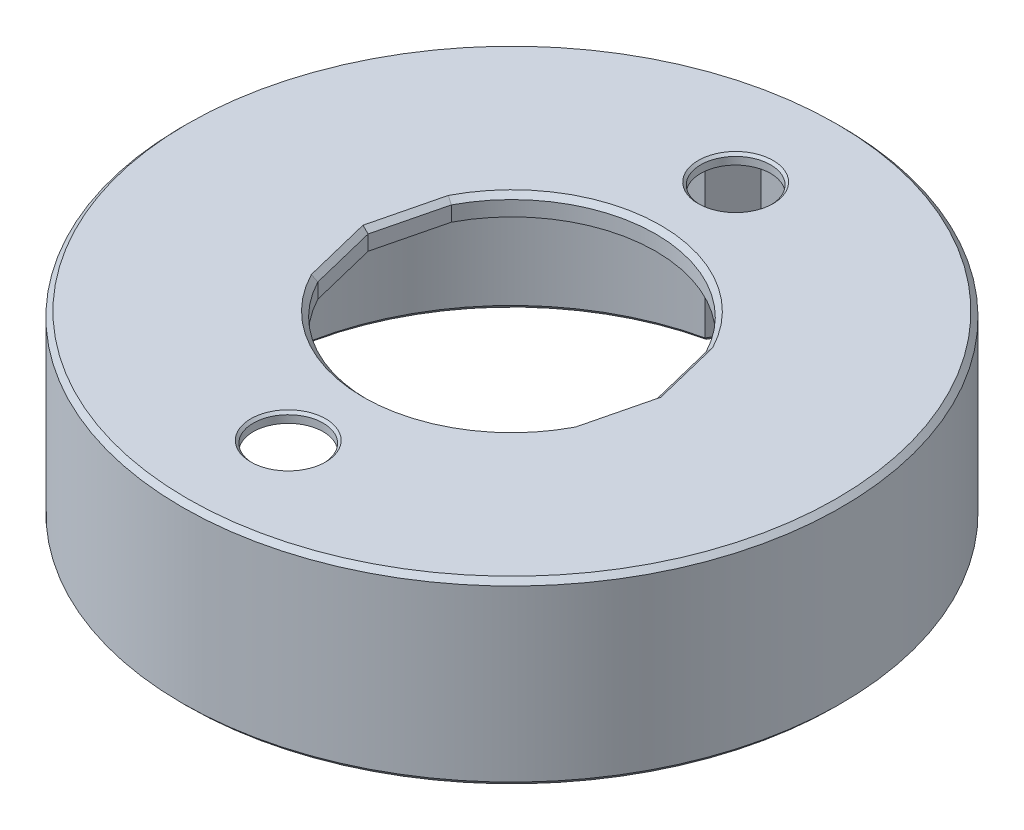
from build123d import *

# Parameters (mm, degrees)
SKETCH1_R           = 16.5
SKETCH1_R_2         = 12.73
BOSS_EXTRUDE1_DEPTH = 8
SKETCH2_R           = 16.5
BOSS_EXTRUDE2_DEPTH = 1
SKETCH3_R           = 1.75
CUT_EXTRUDE1_DEPTH  = 12
CUT_EXTRUDE2_DEPTH  = 12
CUT_EXTRUDE3_DEPTH  = 0.5
CUT_EXTRUDE4_DEPTH  = 17.5
CUT_EXTRUDE5_DEPTH  = 0.5
CHAMFER1_SIZE       = 0.25
CHAMFER2_SIZE       = 0.125
CHAMFER3_SIZE       = 0.25
CHAMFER4_SIZE       = 0.25


with BuildPart() as part:
    # Sketch1 → Boss-Extrude1 (new body)
    with BuildSketch(Plane(origin=(0, 0, 0), x_dir=(1, 0, 0), z_dir=(0, 1, 0))):
        Circle(SKETCH1_R)
        Circle(SKETCH1_R_2, mode=Mode.SUBTRACT)
    extrude(amount=BOSS_EXTRUDE1_DEPTH)

    # Sketch2 → Boss-Extrude2 (add)
    with BuildSketch(Plane(origin=(0, 8, 0), x_dir=(1, 0, 0), z_dir=(0, 1, 0))):
        Circle(SKETCH2_R)
    extrude(amount=BOSS_EXTRUDE2_DEPTH)

    # Sketch3 → Cut-Extrude1 (cut)
    with BuildSketch(Plane(origin=(0, 9, 0), x_dir=(1, 0, 0), z_dir=(0, 1, 0))):
        with Locations((0, 11.2)):
            Circle(SKETCH3_R)
        with BuildLine():
            ThreePointArc((6.37732649, 3.342111136), (0, 7.2), (-6.37732649, 3.342111136))
            Line((-6.37732649, 3.342111136), (-7.2, 0))
            Line((-7.2, 0), (-6.37732649, -3.342111136))
            ThreePointArc((-6.37732649, -3.342111136), (0, -7.2), (6.37732649, -3.342111136))
            Line((6.37732649, -3.342111136), (7.2, 0))
            Line((7.2, 0), (6.37732649, 3.342111136))
        make_face()
        with Locations((0, -11.2)):
            Circle(SKETCH3_R)
    extrude(amount=-CUT_EXTRUDE1_DEPTH, mode=Mode.SUBTRACT)

    # Sketch4 → Cut-Extrude2 (cut)
    with BuildSketch(Plane.XZ.offset(-8)):
        Polygon((3.464101615, 11.2), (1.732050808, 14.2), (-1.732050808, 14.2), (-3.464101615, 11.2), (-1.732050808, 8.2), (1.732050808, 8.2), align=None)
    extrude(amount=CUT_EXTRUDE2_DEPTH, mode=Mode.SUBTRACT)

    # Sketch5 → Cut-Extrude3 (cut)
    with BuildSketch(Plane.XZ.offset(-8)):
        Polygon((3.441649055, 11.2), (1.720824528, 14.180555513), (-1.720824528, 14.180555513), (-3.441649055, 11.2), (-1.720824528, 8.219444487), (1.720824528, 8.219444487), align=None)
    extrude(amount=-CUT_EXTRUDE3_DEPTH, mode=Mode.SUBTRACT)

    # Sketch6 → Cut-Extrude4 (cut)
    with BuildSketch(Plane.XZ.offset(-8)):
        Polygon((3.464101615, -11.2), (1.732050808, -8.2), (-1.732050808, -8.2), (-3.464101615, -11.2), (-1.732050808, -14.2), (1.732050808, -14.2), align=None)
    extrude(amount=CUT_EXTRUDE4_DEPTH, mode=Mode.SUBTRACT)

    # Sketch7 → Cut-Extrude5 (cut)
    with BuildSketch(Plane.XZ.offset(-8)):
        Polygon((3.487584053, -11.2), (1.743792026, -8.179663613), (-1.743792026, -8.179663613), (-3.487584053, -11.2), (-1.743792026, -14.220336387), (1.743792026, -14.220336387), align=None)
    extrude(amount=-CUT_EXTRUDE5_DEPTH, mode=Mode.SUBTRACT)

    # Chamfer1
    chamfer1_edges = [part.edges().sort_by_distance(p)[0] for p in [
        (-6.788663245, 9, 1.671055568),
        (-6.788663245, 9, -1.671055568),
        (0, 9, -7.2),
        (6.788663245, 9, -1.671055568),
        (6.788663245, 9, 1.671055568),
        (0, 9, 7.2),
        (-16.5, 9, 0),
    ]]
    chamfer(chamfer1_edges, length=CHAMFER1_SIZE)

    # Chamfer2
    chamfer2_edges = [part.edges().sort_by_distance(p)[0] for p in [
        (-1.75, 9, -11.2),
        (-1.75, 9, 11.2),
    ]]
    chamfer(chamfer2_edges, length=CHAMFER2_SIZE)

    # Chamfer3
    chamfer3_edges = [part.edges().sort_by_distance(p)[0] for p in [
        (2.24348919, 0, -13.314162737),
        (0, 0, -14.2),
        (-2.24348919, 0, -13.314162737),
        (-12.73, 0, 0),
        (-2.24348919, 0, 13.314162737),
        (0, 0, 14.2),
        (2.24348919, 0, 13.314162737),
        (12.73, 0, 0),
    ]]
    chamfer(chamfer3_edges, length=CHAMFER3_SIZE)

    # Chamfer4
    chamfer4_edges = [part.edges().sort_by_distance(p)[0] for p in [
        (-16.5, 0, 0),
    ]]
    chamfer(chamfer4_edges, length=CHAMFER4_SIZE)


solid = part.part
